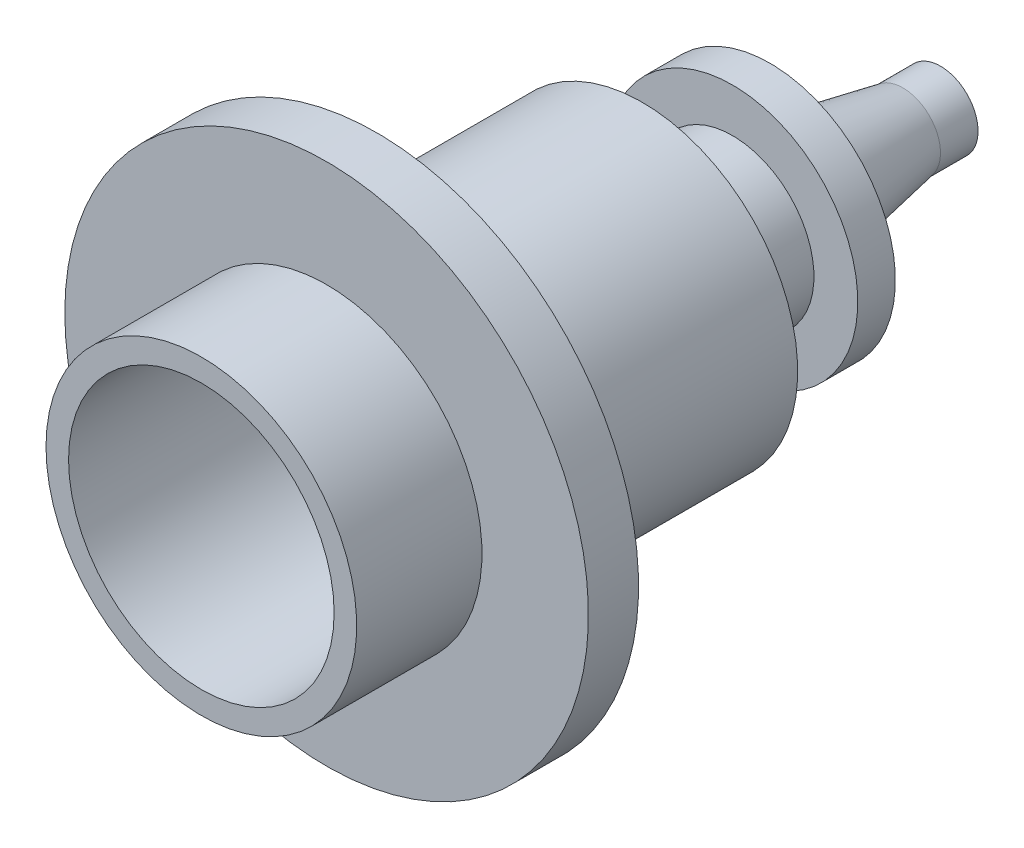
from build123d import *


with BuildPart() as part:
    # Body Sketch → Body Revolve (revolve)
    with BuildSketch(Plane(origin=(0, 0, 0), x_dir=(1, 0, 0), z_dir=(0, 1, 0))):
        Polygon((2.65, -14.75), (3.1, -14.75), (3.1, -12.25), (5.225, -12.25), (5.225, -11.25), (3.1, -11.25), (3.1, -5.95), (1.625, -5.55), (1.625, -4.15), (2.5, -4.15), (2.5, -3.4), (0.25, -3.4), (0.25, -5.954207714), (2.65, -6.605055172), align=None)
    revolve(axis=Axis((0, 0, 0), (0, 0, 1)))

    # N08 Sketch → N08 Revolve (revolve)
    with BuildSketch(Plane(origin=(0, 0, 0), x_dir=(1, 0, 0), z_dir=(0, 1, 0))):
        Polygon((0.5, 0), (0.75, 0), (0.75, -0.75), (1.25, -3.4), (0.5, -3.4), align=None)
    revolve(axis=Axis((0, 0, 0), (0, 0, 1)))


solid = part.part
